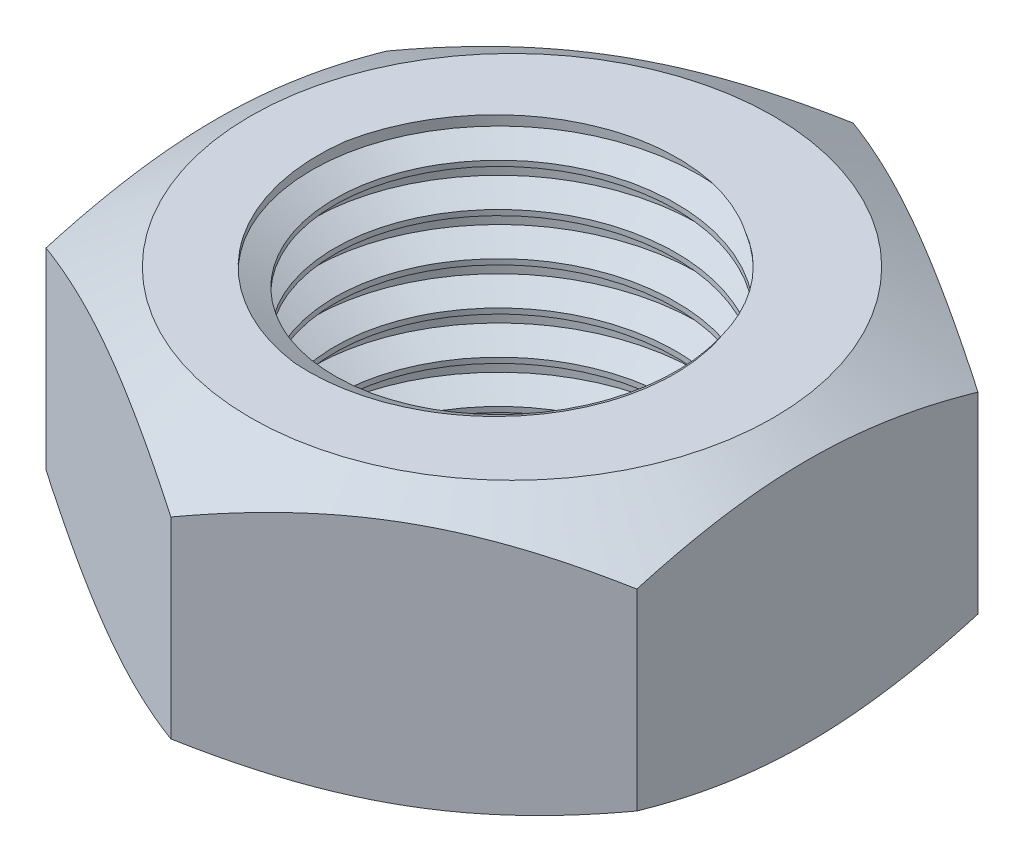
from build123d import *

# Parameters (mm, degrees)
SKETCH1_R           = 6
BOSS_EXTRUDE1_DEPTH = 5
THREAD1_PITCH       = 1.5


with BuildPart() as part:
    # Sketch1 → Boss-Extrude1 (new, symmetric)
    with BuildSketch(Plane(origin=(0, 0, 0), x_dir=(1, 0, 0), z_dir=(0, 1, 0))):
        Polygon((10.392304845, 6), (0, 12), (-10.392304845, 6), (-10.392304845, -6), (0, -12), (10.392304845, -6), align=None)
        with Locations(Location((0, 0, 0), (0, 0, 270))):
            Circle(SKETCH1_R, mode=Mode.SUBTRACT)
    extrude(amount=BOSS_EXTRUDE1_DEPTH, both=True)

    # Thread1: the profile of Thread Profile1 profile screwed along a right-hand helix of 18 turns, 8 arcs to a turn; built about Z, then put on its axis
    thread1_z = Axis((0, 0, 0), (0, 0, 1))
    thread1_corners = [(5.9997, 0, -0.000173205), (5.9997, 0, 1.312673201), (6.811898813, 0, 0.843749998), (6.811898813, 0, 0.468749998)]
    with BuildLine(mode=Mode.PRIVATE) as thread1_profile:
        Line(thread1_corners[0], thread1_corners[1])
        Line(thread1_corners[1], thread1_corners[2])
        Line(thread1_corners[2], thread1_corners[3])
        Line(thread1_corners[3], thread1_corners[0])
    thread1_cap = Face(thread1_profile.wire())
    thread1_turn_angles = [0, 22.5, 45, 67.5, 90, 112.5, 135, 157.5, 180, 202.5, 225, 247.5, 270, 292.5, 315, 337.5, 360]
    thread1_turn_weights = [1, 0.9238795325112867, 1, 0.9238795325112867, 1, 0.9238795325112867, 1, 0.9238795325112867, 1, 0.9238795325112867, 1, 0.9238795325112867, 1, 0.9238795325112867, 1, 0.9238795325112867, 1]
    thread1_turn_rails = [Edge.make_bspline([Vector(p[0], p[1], 0).rotate(thread1_z, thread1_turn_angles[k]) / thread1_turn_weights[k] + Vector(0, 0, p[2] + THREAD1_PITCH * thread1_turn_angles[k] / 360) for k in range(17)], [0, 0, 0, 1, 1, 2, 2, 3, 3, 4, 4, 5, 5, 6, 6, 7, 7, 8, 8, 8], 2, thread1_turn_weights) for p in thread1_corners]
    thread1_turn_sides = [Face.make_surface_from_curves(thread1_turn_rails[p[0]], thread1_turn_rails[p[1]]) for p in [(0, 1), (1, 2), (2, 3), (3, 0)]]
    thread1 = Plane(origin=(0, 7, 0), x_dir=(-1, 0, 0), z_dir=(0, -1, 0)) * Solid(Shell([*[p.moved(Location((0, 0, THREAD1_PITCH * i))) for i in range(18) for p in thread1_turn_sides], thread1_cap, thread1_cap.rotate(thread1_z, 6480).moved(Location((0, 0, THREAD1_PITCH * 6480 / 360)))]))
    add(thread1, mode=Mode.SUBTRACT)

    # Sketch5 → Cut-Revolve4 (revolve, cut)
    with BuildSketch(Plane(origin=(0, 0, 0), x_dir=(0, 0, -1), z_dir=(1, 0, 0))):
        Polygon((12, 3.380820618), (12, 5), (9.195499043, 5), align=None)
    cut_revolve4 = revolve(axis=Axis((0, 0, 0), (0, 1, 0)), mode=Mode.SUBTRACT)

    # Mirror1: Cut-Revolve4 across plane
    add(cut_revolve4.mirror(Plane.ZX), mode=Mode.SUBTRACT)


solid = part.part
